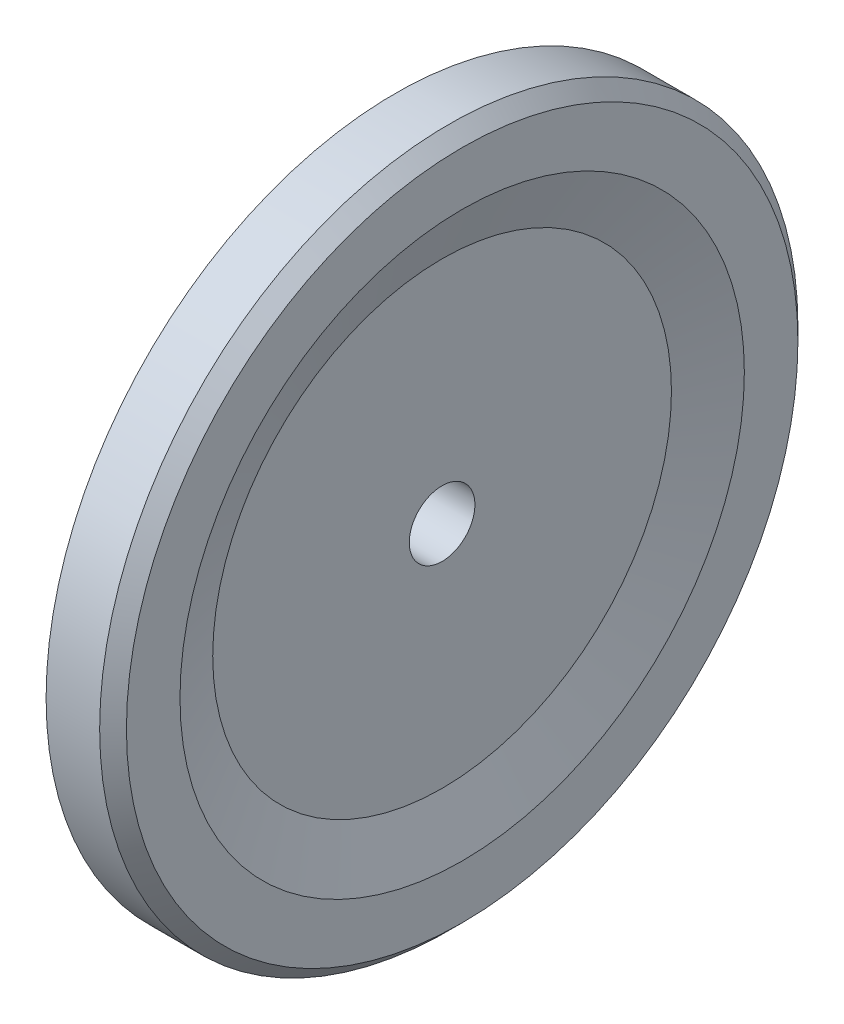
from build123d import *

# Parameters (mm, degrees)
CHAMFER1_SIZE = 2


with BuildPart() as part:
    # Sketch1 → Revolve1 (revolve)
    with BuildSketch(Plane(origin=(0, 0, 0), x_dir=(1, 0, 0), z_dir=(0, 1, 0))):
        Polygon((0, 4.9022), (0, 52.15), (10, 52.15), (10, 42.15), (7, 34.26), (7, 4.9022), align=None)
    revolve(axis=Axis((0, 0, 0), (1, 0, 0)))

    # Chamfer1
    chamfer1_edges = [part.edges().sort_by_distance(p)[0] for p in [
        (10, 0, 52.15),
    ]]
    chamfer(chamfer1_edges, length=CHAMFER1_SIZE)


solid = part.part
